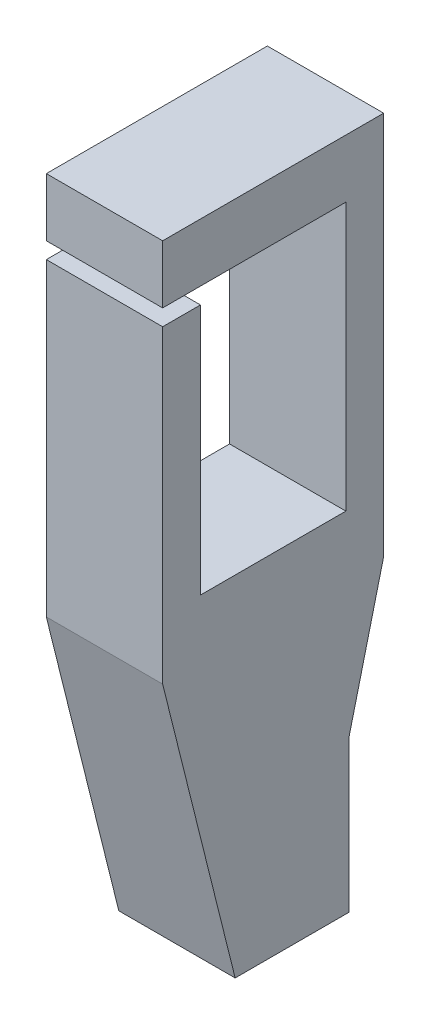
from build123d import *

# Parameters (mm, degrees)
SKETCH1_W           = 12.5
SKETCH1_H           = 23
BOSS_EXTRUDE1_DEPTH = 5
SKETCH4_W           = 3.25
SKETCH4_H           = 1.4
CUT_EXTRUDE1_DEPTH  = 44.732139211


# Read off the part's stored shape, not the designer's step: CSK for M2 Flat Head Machine Screw1
with BuildPart() as part:
    # Sketch1 → Boss-Extrude1 (new, symmetric)
    with BuildSketch(Plane(origin=(0, 0, 0), x_dir=(0, 0, -1), z_dir=(1, 0, 0))):
        Polygon((-9.5, -16.5), (-3.266799929, -41.5), (6.508063966, -41.5), (6.508063966, -28.5), (9.5, -16.5), (9.5, 16.5), (-9.5, 16.5), align=None)
        Rectangle(SKETCH1_W, SKETCH1_H, mode=Mode.SUBTRACT)
    extrude(amount=BOSS_EXTRUDE1_DEPTH, both=True)

    # CSK for M2 Flat Head Machine Screw1 outl → CSK for M2 Flat Head Machine Screw1 (revolve, cut)
    with BuildSketch(Plane(origin=(0, 13.9, 0), x_dir=(0, 1, 0), z_dir=(0, 0, -1))):
        Polygon((0.87, 3), (0, 3.522748739), (0, -5), (1.5, -5), (0.87, -4.37), align=None)
    revolve(axis=Axis((0, 13.9, 0), (1, 0, 0)), mode=Mode.SUBTRACT)

    # CSK for M2 Flat Head Machine Screw1 2 ou → CSK for M2 Flat Head Machine Screw1 2 (revolve, cut)
    with BuildSketch(Plane(origin=(0, -13.9, 0), x_dir=(0, 1, 0), z_dir=(0, 0, -1))):
        Polygon((0.87, 3), (0, 3.522748739), (0, -5), (1.5, -5), (0.87, -4.37), align=None)
    revolve(axis=Axis((0, -13.9, 0), (1, 0, 0)), mode=Mode.SUBTRACT)

    # Sketch4 → Cut-Extrude1 (cut, through all)
    with BuildSketch(Plane(origin=(5, 0, 0), x_dir=(0, 0, -1), z_dir=(1, 0, 0))):
        with Locations((-7.875, 10.8)):
            Rectangle(SKETCH4_W, SKETCH4_H)
    extrude(amount=-CUT_EXTRUDE1_DEPTH, mode=Mode.SUBTRACT)


solid = part.part
